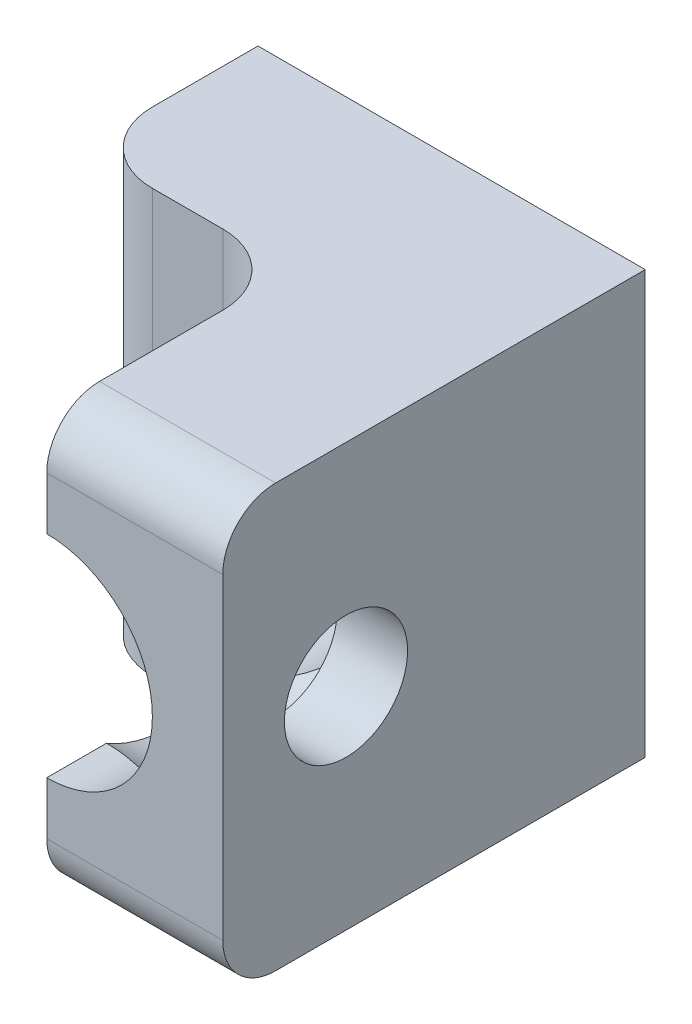
from build123d import *
from build123d.topology import SkipClean

# Parameters (mm, degrees)
SKETCH_1_W          = 12
SKETCH_1_H          = 12
SKETCH_1_R          = 3
EXTRUDE_1_DEPTH     = 5
EXTRUDE_2_DEPTH     = 7
SKETCH_4_R          = 1.75
CUT_EXTRUDE_1_DEPTH = 7
SKETCH_5_R          = 3.5
CUT_EXTRUDE_2_DEPTH = 3
FILLET_1_R          = 2
FILLET_2_R          = 1.5
FILLET_3_R          = 2
SKETCH_6_W          = 51.167953154
SKETCH_6_H          = 21.993207172
CUT_EXTRUDE_3_DEPTH = 1


with BuildPart() as part:
    # 草图1 → 凸台-拉伸1 (new body)
    with BuildSketch(Plane.XY):
        Rectangle(SKETCH_1_W, SKETCH_1_H)
        Circle(SKETCH_1_R, mode=Mode.SUBTRACT)
    extrude(amount=EXTRUDE_1_DEPTH)

    # 草图3 → 凸台-拉伸2 (add)
    with BuildSketch(Plane.XY.offset(5)):
        with BuildLine():
            Line((0, -6), (6, -6))
            Line((6, -6), (6, 6))
            Line((6, 6), (0, 6))
            Line((0, 6), (0, 3))
            ThreePointArc((0, 3), (3, 0), (0, -3))
            Line((0, -3), (0, -6))
        make_face()
    extrude(amount=EXTRUDE_2_DEPTH)

    # 草图4 → 切除-拉伸1 (cut)
    with BuildSketch(Plane.ZY):
        with Locations((8.5, 0)):
            Circle(SKETCH_4_R)
    extrude(amount=-CUT_EXTRUDE_1_DEPTH, mode=Mode.SUBTRACT)

    # 草图5 → 切除-拉伸2 (cut)
    with SkipClean():  # the faces are left unmerged after this step: merging them gives an invalid solid
        with BuildSketch(Plane.ZY):
            with Locations((8.5, 0)):
                Circle(SKETCH_5_R)
        extrude(amount=-CUT_EXTRUDE_2_DEPTH, mode=Mode.SUBTRACT)

    # 圆角1
    # the kernel refuses this fillet: 2 mm, written as the material it adds along each edge
    with BuildSketch(Plane(origin=(0, 2, 5), x_dir=(-1, 0, 0), z_dir=(0, -1, 0))) as fillet_1_piece_1_section:
        with BuildLine():
            CenterArc((FILLET_1_R, -FILLET_1_R), FILLET_1_R, 90, 90)
            Line((0, -FILLET_1_R), (0, 0))
            Line((0, 0), (FILLET_1_R, 0))
        make_face()
    fillet_1_piece_1 = extrude(amount=8, mode=Mode.PRIVATE)
    fillet_1_piece_1 = fillet_1_piece_1 - Plane(origin=(0, 0, 5), x_dir=(1, 0, 0), z_dir=(0, 0, -1)) * Cylinder(3, 24, mode=Mode.PRIVATE)
    fillet_1_piece_1 = fillet_1_piece_1 - Plane(origin=(0, 0, 8.5), x_dir=(0, 0, 1), z_dir=(-1, 0, 0)) * Cylinder(3.5, 24, mode=Mode.PRIVATE)
    add(fillet_1_piece_1)
    with BuildSketch(Plane(origin=(0, 6, 5), x_dir=(-1, 0, 0), z_dir=(0, -1, 0))) as fillet_1_piece_2_section:
        with BuildLine():
            CenterArc((FILLET_1_R, -FILLET_1_R), FILLET_1_R, 90, 90)
            Line((0, -FILLET_1_R), (0, 0))
            Line((0, 0), (FILLET_1_R, 0))
        make_face()
    fillet_1_piece_2 = extrude(amount=8, mode=Mode.PRIVATE)
    fillet_1_piece_2 = fillet_1_piece_2 - Plane(origin=(0, 0, 5), x_dir=(1, 0, 0), z_dir=(0, 0, -1)) * Cylinder(3, 24, mode=Mode.PRIVATE)
    fillet_1_piece_2 = fillet_1_piece_2 - Plane(origin=(0, 0, 8.5), x_dir=(0, 0, 1), z_dir=(-1, 0, 0)) * Cylinder(3.5, 24, mode=Mode.PRIVATE)
    add(fillet_1_piece_2)

    # 圆角2
    fillet_2_edges = [part.edges().sort_by_distance(p)[0] for p in [
        (3, 6, 12),
        (3, -6, 12),
    ]]
    fillet(fillet_2_edges, radius=FILLET_2_R)

    # 圆角3
    fillet_3_edges = [part.edges().sort_by_distance(p)[0] for p in [
        (-6, 0, 5),
    ]]
    fillet(fillet_3_edges, radius=FILLET_3_R)

    # 草图6 → 切除-拉伸3 (cut)
    with BuildSketch(Plane(origin=(6, 0, 0), x_dir=(0, 0, -1), z_dir=(1, 0, 0))):
        with Locations((-8.5, 0)):
            Rectangle(SKETCH_6_W, SKETCH_6_H)
    extrude(amount=-CUT_EXTRUDE_3_DEPTH, mode=Mode.SUBTRACT)


solid = part.part
